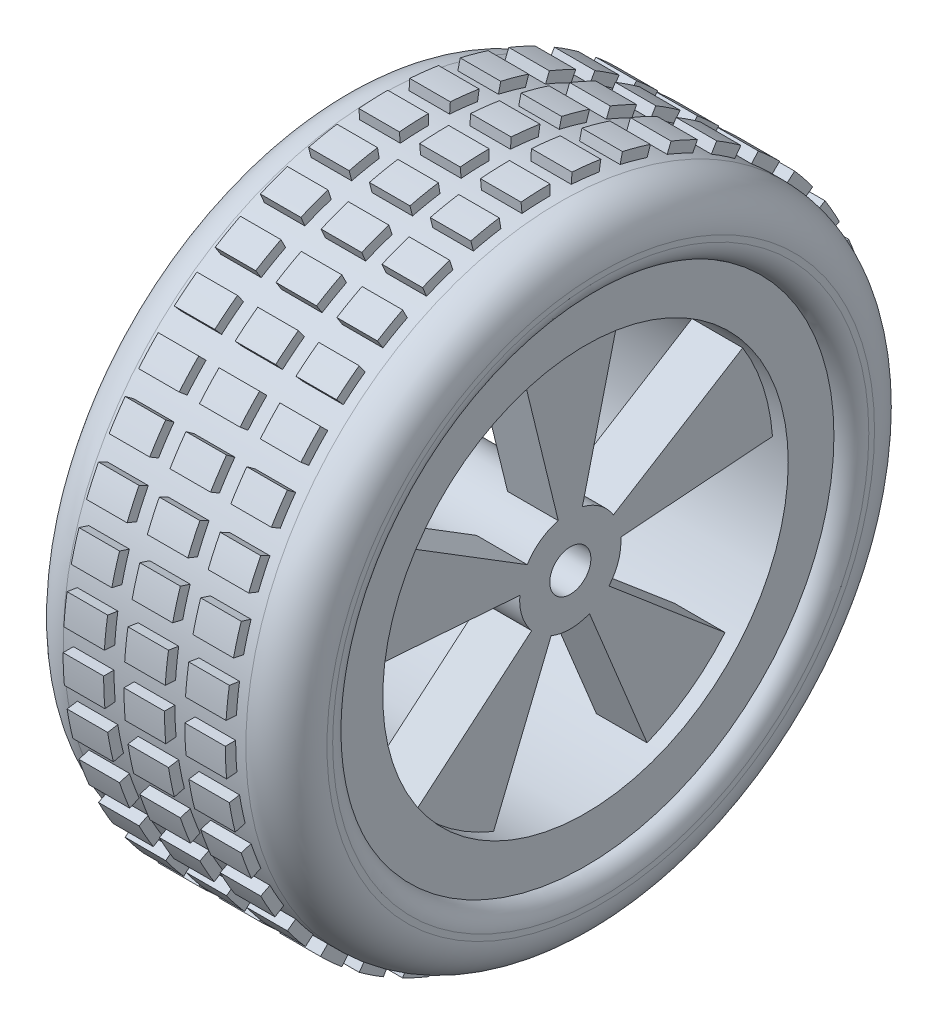
from build123d import *

# Parameters (mm, degrees)
BOSS_EXTRUDE1_DEPTH      = 13
BOSS_EXTRUDE1_DEPTH_BACK = 13
SKETCH2_R                = 31
CUT_EXTRUDE1_DEPTH       = 26
SKETCH4_R                = 2.02783292
CUT_EXTRUDE2_DEPTH       = 26
SKETCH5_R                = 19.992860578
CUT_EXTRUDE3_DEPTH       = 3
SKETCH6_R                = 24.5
CUT_EXTRUDE4_DEPTH       = 1.5
FILLET2_R                = 4
FILLET3_R                = 2
CUT_EXTRUDE5_START       = -18
SKETCH7_R                = 19.992860578
CUT_EXTRUDE5_DEPTH       = 18
SKETCH8_R                = 4.994799617
SKETCH8_R_2              = 2.02783292
BOSS_EXTRUDE2_DEPTH      = 19
BOSS_EXTRUDE3_DEPTH      = 2
MIRROR2_COPY_1_DEPTH     = 2
MIRROR2_COPY_2_DEPTH     = 2
CUT_EXTRUDE7_START       = -1
SKETCH11_R               = 24.5
SKETCH11_R_2             = 19.992860578
CUT_EXTRUDE7_DEPTH       = 1
FILLET4_R                = 1


# Some blends are built 0.0001 mm under size
with BuildPart() as part:
    # Sketch2 → Boss-Extrude1 (new, two sides: drawn at the far end of the back side and taken through both)
    with BuildSketch(Plane(origin=(0, 0, 0), x_dir=(0, 0, -1), z_dir=(1, 0, 0)).offset(-BOSS_EXTRUDE1_DEPTH_BACK)):
        Circle(SKETCH2_R)
    extrude(amount=BOSS_EXTRUDE1_DEPTH + BOSS_EXTRUDE1_DEPTH_BACK)

    # Sketch3 → Cut-Extrude1 (cut)
    with BuildSketch(Plane(origin=(13, 0, 0), x_dir=(0, 0, -1), z_dir=(1, 0, 0))):
        with BuildLine():
            ThreePointArc((1.186772646, 4.851761938), (2.935869553, 4.040877774), (4.247566891, 2.62796475))
            Line((4.247566891, 2.62796475), (17.001885791, 10.519047184))
            ThreePointArc((17.001885791, 10.519047184), (11.751508599, 16.174563974), (4.750336723, 19.420318615))
            Line((4.750336723, 19.420318615), (1.186772646, 4.851761938))
        make_face()
        with BuildLine():
            ThreePointArc((-4.247566891, 2.62796475), (-2.935869553, 4.040877774), (-1.186772646, 4.851761938))
            Line((-1.186772646, 4.851761938), (-4.750336723, 19.420318615))
            ThreePointArc((-4.750336723, 19.420318615), (-11.751508599, 16.174563974), (-17.001885791, 10.519047184))
            Line((-17.001885791, 10.519047184), (-4.247566891, 2.62796475))
        make_face()
        with BuildLine():
            Line((-15.258080015, -12.919189926), (-3.811913354, -3.227590401))
            ThreePointArc((-3.811913354, -3.227590401), (-4.750336723, -1.543477965), (-4.981032723, 0.370589033))
            Line((-4.981032723, 0.370589033), (-19.937755344, 1.483369793))
            ThreePointArc((-19.937755344, 1.483369793), (-19.014340332, -6.178133685), (-15.258080015, -12.919189926))
        make_face()
        with BuildLine():
            Line((7.571873739, -18.503545665), (1.891674876, -4.622725319))
            ThreePointArc((1.891674876, -4.622725319), (0, -4.994799617), (-1.891674876, -4.622725319))
            Line((-1.891674876, -4.622725319), (-7.571873739, -18.503545665))
            ThreePointArc((-7.571873739, -18.503545665), (0, -19.992860578), (7.571873739, -18.503545665))
        make_face()
        with BuildLine():
            Line((19.937755344, 1.483369793), (4.981032723, 0.370589033))
            ThreePointArc((4.981032723, 0.370589033), (4.991356707, 0.185422328), (4.994799617, 0))
            ThreePointArc((4.994799617, 0), (4.689763671, -1.718761161), (3.811913354, -3.227590401))
            Line((3.811913354, -3.227590401), (15.258080015, -12.919189926))
            ThreePointArc((15.258080015, -12.919189926), (18.771882438, -6.879745913), (19.992860578, 0))
            ThreePointArc((19.992860578, 0), (19.97907952, 0.742196492), (19.937755344, 1.483369793))
        make_face()
    extrude(amount=-CUT_EXTRUDE1_DEPTH, mode=Mode.SUBTRACT)

    # Sketch4 → Cut-Extrude2 (cut)
    with BuildSketch(Plane(origin=(13, 0, 0), x_dir=(0, 0, -1), z_dir=(1, 0, 0))):
        Circle(SKETCH4_R)
    extrude(amount=-CUT_EXTRUDE2_DEPTH, mode=Mode.SUBTRACT)

    # Sketch5 → Cut-Extrude3 (cut)
    with BuildSketch(Plane(origin=(13, 0, 0), x_dir=(0, 0, -1), z_dir=(1, 0, 0))):
        Circle(SKETCH5_R)
    extrude(amount=-CUT_EXTRUDE3_DEPTH, mode=Mode.SUBTRACT)

    # Sketch6 → Cut-Extrude4 (cut)
    with BuildSketch(Plane(origin=(13, 0, 0), x_dir=(0, 0, -1), z_dir=(1, 0, 0))):
        Circle(SKETCH6_R)
    extrude(amount=-CUT_EXTRUDE4_DEPTH, mode=Mode.SUBTRACT)

    # Fillet2
    fillet2_edges = [part.edges().sort_by_distance(p)[0] for p in [
        (-13, 0, 31),
        (13, 0, 31),
    ]]
    fillet(fillet2_edges, radius=FILLET2_R)

    # Fillet3
    # the kernel refuses this fillet: 2 mm, written as the material it takes off along each edge
    with BuildSketch(Plane(origin=(13, 0, 0), x_dir=(0, 0, -1), z_dir=(0, -1, 0))) as fillet3_piece_1:
        with BuildLine():
            CenterArc((26.436491673, -2), FILLET3_R, 90, 75.522487814)
            Line((24.5, -1.5), (24.461270167, -1.49))
            ThreePointArc((24.461270167, -1.49), (24.46, -0.75), (24.46, 0))
            Line((24.46, 0), (24.5, 0.04))
            Line((24.5, 0.04), (26.436491673, 0.04))
            Line((26.436491673, 0.04), (26.436491673, 0))
        make_face()
    revolve(axis=Axis((13, 0, 0), (1, 0, 0)), mode=Mode.SUBTRACT)

    # Sketch7 → Cut-Extrude5 (cut)
    with BuildSketch(Plane.ZY.offset(13).offset(CUT_EXTRUDE5_START)):
        with Locations(Location((0, 0, 0), (0, 0, 180))):
            Circle(SKETCH7_R)
    extrude(amount=CUT_EXTRUDE5_DEPTH, mode=Mode.SUBTRACT)

    # Sketch8 → Boss-Extrude2 (add)
    with BuildSketch(Plane.ZY.offset(-5)):
        with Locations(Location((0, 0, 0), (0, 0, 175.7450311))):
            Circle(SKETCH8_R)
        with Locations(Location((0, 0, 0), (0, 0, 180))):
            Circle(SKETCH8_R_2, mode=Mode.SUBTRACT)
    extrude(amount=BOSS_EXTRUDE2_DEPTH)

    # Sketch9 → Boss-Extrude3 (add, symmetric)
    with BuildSketch(Plane(origin=(0, 0, 0), x_dir=(0, 0, -1), z_dir=(1, 0, 0))):
        with BuildLine():
            Line((0, 31), (0, 32.019953226))
            ThreePointArc((0, 32.019953226), (-1.429439719, 31.988030678), (-2.856029255, 31.892326686))
            Line((-2.856029255, 31.892326686), (-2.765054224, 30.876438835))
            ThreePointArc((-2.765054224, 30.876438835), (-1.383906809, 30.969094303), (0, 31))
        make_face()
        with BuildLine():
            Line((2.099127373, 30.928848415), (2.168192268, 31.946460631))
            ThreePointArc((2.168192268, 31.946460631), (3.592189523, 31.817818577), (5.009024253, 31.625734467))
            Line((5.009024253, 31.625734467), (4.849468416, 30.618338558))
            ThreePointArc((4.849468416, 30.618338558), (3.47776508, 30.804304083), (2.099127373, 30.928848415))
        make_face()
        with BuildLine():
            Line((6.911621488, 30.2196871), (7.139025702, 31.213966691))
            ThreePointArc((7.139025702, 31.213966691), (8.525367137, 30.864146185), (9.894709706, 30.452785167))
            Line((9.894709706, 30.452785167), (9.579526826, 29.482752005))
            ThreePointArc((9.579526826, 29.482752005), (8.253802851, 29.881009663), (6.911621488, 30.2196871))
        make_face()
        with BuildLine():
            Line((11.553928544, 28.766416795), (11.93407263, 29.712881298))
            ThreePointArc((11.93407263, 29.712881298), (13.248621918, 29.150496082), (14.536754567, 28.529987228))
            Line((14.536754567, 28.529987228), (14.073705492, 27.62120225))
            ThreePointArc((14.073705492, 27.62120225), (12.826604603, 28.221945616), (11.553928544, 28.766416795))
        make_face()
        with BuildLine():
            Line((15.911739533, 26.604821838), (16.435263083, 27.480166156))
            ThreePointArc((16.435263083, 27.480166156), (17.645651657, 26.719064021), (18.820856285, 25.904686319))
            Line((18.820856285, 25.904686319), (18.221342821, 25.079526826))
            ThreePointArc((18.221342821, 25.079526826), (17.083572781, 25.867963604), (15.911739533, 26.604821838))
        make_face()
        with BuildLine():
            Line((19.877750687, 23.788127871), (20.531762814, 24.570798121))
            ThreePointArc((20.531762814, 24.570798121), (21.608186891, 23.629719928), (22.641526059, 22.641526059))
            Line((22.641526059, 22.641526059), (21.920310217, 21.920310217))
            ThreePointArc((21.920310217, 21.920310217), (20.9198867, 22.877026478), (19.877750687, 23.788127871))
        make_face()
        with BuildLine():
            Line((23.354305649, 20.385691248), (24.122702403, 21.056415492))
            ThreePointArc((24.122702403, 21.056415492), (25.038656849, 19.958533708), (25.904686319, 18.820856285))
            Line((25.904686319, 18.820856285), (25.079526826, 18.221342821))
            ThreePointArc((25.079526826, 18.221342821), (24.241083579, 19.322781035), (23.354305649, 20.385691248))
        make_face()
        with BuildLine():
            Line((26.255800097, 16.48129125), (27.119661, 17.02355403))
            ThreePointArc((27.119661, 17.02355403), (27.852591978, 15.795902149), (28.529987228, 14.536754567))
            Line((28.529987228, 14.536754567), (27.62120225, 14.073705492))
            ThreePointArc((27.62120225, 14.073705492), (26.965384528, 15.292744595), (26.255800097, 16.48129125))
        make_face()
        with BuildLine():
            Line((28.510789609, 12.171067164), (29.448843538, 12.57151617))
            ThreePointArc((29.448843538, 12.57151617), (29.980703854, 11.244323056), (30.452785167, 9.894709706))
            Line((30.452785167, 9.894709706), (29.482752005, 9.579526826))
            ThreePointArc((29.482752005, 9.579526826), (29.025708218, 10.886150029), (28.510789609, 12.171067164))
        make_face()
        with BuildLine():
            Line((30.063748858, 7.56115101), (31.052897814, 7.80992586))
            ThreePointArc((31.052897814, 7.80992586), (31.370591302, 6.415871411), (31.625734467, 5.009024253))
            Line((31.625734467, 5.009024253), (30.618338558, 4.849468416))
            ThreePointArc((30.618338558, 4.849468416), (30.37132264, 6.21150232), (30.063748858, 7.56115101))
        make_face()
        with BuildLine():
            Line((30.876438835, 2.765054224), (31.892326686, 2.856029255))
            ThreePointArc((31.892326686, 2.856029255), (31.988030678, 1.429439719), (32.019953226, 0))
            Line((32.019953226, 0), (31, 0))
            ThreePointArc((31, 0), (30.969094303, 1.383906809), (30.876438835, 2.765054224))
        make_face()
        with BuildLine():
            Line((30.928848415, -2.099127373), (31.946460631, -2.168192268))
            ThreePointArc((31.946460631, -2.168192268), (31.817818577, -3.592189523), (31.625734467, -5.009024253))
            Line((31.625734467, -5.009024253), (30.618338558, -4.849468416))
            ThreePointArc((30.618338558, -4.849468416), (30.804304083, -3.47776508), (30.928848415, -2.099127373))
        make_face()
        with BuildLine():
            Line((30.2196871, -6.911621488), (31.213966691, -7.139025702))
            ThreePointArc((31.213966691, -7.139025702), (30.864146185, -8.525367137), (30.452785167, -9.894709706))
            Line((30.452785167, -9.894709706), (29.482752005, -9.579526826))
            ThreePointArc((29.482752005, -9.579526826), (29.881009663, -8.253802851), (30.2196871, -6.911621488))
        make_face()
        with BuildLine():
            Line((28.766416795, -11.553928544), (29.712881298, -11.93407263))
            ThreePointArc((29.712881298, -11.93407263), (29.150496082, -13.248621918), (28.529987228, -14.536754567))
            Line((28.529987228, -14.536754567), (27.62120225, -14.073705492))
            ThreePointArc((27.62120225, -14.073705492), (28.221945616, -12.826604603), (28.766416795, -11.553928544))
        make_face()
        with BuildLine():
            Line((26.604821838, -15.911739533), (27.480166156, -16.435263083))
            ThreePointArc((27.480166156, -16.435263083), (26.719064021, -17.645651657), (25.904686319, -18.820856285))
            Line((25.904686319, -18.820856285), (25.079526826, -18.221342821))
            ThreePointArc((25.079526826, -18.221342821), (25.867963604, -17.083572781), (26.604821838, -15.911739533))
        make_face()
        with BuildLine():
            Line((23.788127871, -19.877750687), (24.570798121, -20.531762814))
            ThreePointArc((24.570798121, -20.531762814), (23.629719928, -21.608186891), (22.641526059, -22.641526059))
            Line((22.641526059, -22.641526059), (21.920310217, -21.920310217))
            ThreePointArc((21.920310217, -21.920310217), (22.877026478, -20.9198867), (23.788127871, -19.877750687))
        make_face()
        with BuildLine():
            Line((20.385691248, -23.354305649), (21.056415492, -24.122702403))
            ThreePointArc((21.056415492, -24.122702403), (19.958533708, -25.038656849), (18.820856285, -25.904686319))
            Line((18.820856285, -25.904686319), (18.221342821, -25.079526826))
            ThreePointArc((18.221342821, -25.079526826), (19.322781035, -24.241083579), (20.385691248, -23.354305649))
        make_face()
        with BuildLine():
            Line((16.48129125, -26.255800097), (17.02355403, -27.119661))
            ThreePointArc((17.02355403, -27.119661), (15.795902149, -27.852591978), (14.536754567, -28.529987228))
            Line((14.536754567, -28.529987228), (14.073705492, -27.62120225))
            ThreePointArc((14.073705492, -27.62120225), (15.292744595, -26.965384528), (16.48129125, -26.255800097))
        make_face()
        with BuildLine():
            Line((12.171067164, -28.510789609), (12.57151617, -29.448843538))
            ThreePointArc((12.57151617, -29.448843538), (11.244323056, -29.980703854), (9.894709706, -30.452785167))
            Line((9.894709706, -30.452785167), (9.579526826, -29.482752005))
            ThreePointArc((9.579526826, -29.482752005), (10.886150029, -29.025708218), (12.171067164, -28.510789609))
        make_face()
        with BuildLine():
            Line((7.56115101, -30.063748858), (7.80992586, -31.052897814))
            ThreePointArc((7.80992586, -31.052897814), (6.415871411, -31.370591302), (5.009024253, -31.625734467))
            Line((5.009024253, -31.625734467), (4.849468416, -30.618338558))
            ThreePointArc((4.849468416, -30.618338558), (6.21150232, -30.37132264), (7.56115101, -30.063748858))
        make_face()
        with BuildLine():
            Line((2.765054224, -30.876438835), (2.856029255, -31.892326686))
            ThreePointArc((2.856029255, -31.892326686), (1.429439719, -31.988030678), (0, -32.019953226))
            Line((0, -32.019953226), (0, -31))
            ThreePointArc((0, -31), (1.383906809, -30.969094303), (2.765054224, -30.876438835))
        make_face()
        with BuildLine():
            Line((-2.099127373, -30.928848415), (-2.168192268, -31.946460631))
            ThreePointArc((-2.168192268, -31.946460631), (-3.592189523, -31.817818577), (-5.009024253, -31.625734467))
            Line((-5.009024253, -31.625734467), (-4.849468416, -30.618338558))
            ThreePointArc((-4.849468416, -30.618338558), (-3.47776508, -30.804304083), (-2.099127373, -30.928848415))
        make_face()
        with BuildLine():
            Line((-6.911621488, -30.2196871), (-7.139025702, -31.213966691))
            ThreePointArc((-7.139025702, -31.213966691), (-8.525367137, -30.864146185), (-9.894709706, -30.452785167))
            Line((-9.894709706, -30.452785167), (-9.579526826, -29.482752005))
            ThreePointArc((-9.579526826, -29.482752005), (-8.253802851, -29.881009663), (-6.911621488, -30.2196871))
        make_face()
        with BuildLine():
            Line((-11.553928544, -28.766416795), (-11.93407263, -29.712881298))
            ThreePointArc((-11.93407263, -29.712881298), (-13.248621918, -29.150496082), (-14.536754567, -28.529987228))
            Line((-14.536754567, -28.529987228), (-14.073705492, -27.62120225))
            ThreePointArc((-14.073705492, -27.62120225), (-12.826604603, -28.221945616), (-11.553928544, -28.766416795))
        make_face()
        with BuildLine():
            Line((-15.911739533, -26.604821838), (-16.435263083, -27.480166156))
            ThreePointArc((-16.435263083, -27.480166156), (-17.645651657, -26.719064021), (-18.820856285, -25.904686319))
            Line((-18.820856285, -25.904686319), (-18.221342821, -25.079526826))
            ThreePointArc((-18.221342821, -25.079526826), (-17.083572781, -25.867963604), (-15.911739533, -26.604821838))
        make_face()
        with BuildLine():
            Line((-19.877750687, -23.788127871), (-20.531762814, -24.570798121))
            ThreePointArc((-20.531762814, -24.570798121), (-21.608186891, -23.629719928), (-22.641526059, -22.641526059))
            Line((-22.641526059, -22.641526059), (-21.920310217, -21.920310217))
            ThreePointArc((-21.920310217, -21.920310217), (-20.9198867, -22.877026478), (-19.877750687, -23.788127871))
        make_face()
        with BuildLine():
            Line((-23.354305649, -20.385691248), (-24.122702403, -21.056415492))
            ThreePointArc((-24.122702403, -21.056415492), (-25.038656849, -19.958533708), (-25.904686319, -18.820856285))
            Line((-25.904686319, -18.820856285), (-25.079526826, -18.221342821))
            ThreePointArc((-25.079526826, -18.221342821), (-24.241083579, -19.322781035), (-23.354305649, -20.385691248))
        make_face()
        with BuildLine():
            Line((-26.255800097, -16.48129125), (-27.119661, -17.02355403))
            ThreePointArc((-27.119661, -17.02355403), (-27.852591978, -15.795902149), (-28.529987228, -14.536754567))
            Line((-28.529987228, -14.536754567), (-27.62120225, -14.073705492))
            ThreePointArc((-27.62120225, -14.073705492), (-26.965384528, -15.292744595), (-26.255800097, -16.48129125))
        make_face()
        with BuildLine():
            Line((-28.510789609, -12.171067164), (-29.448843538, -12.57151617))
            ThreePointArc((-29.448843538, -12.57151617), (-29.980703854, -11.244323056), (-30.452785167, -9.894709706))
            Line((-30.452785167, -9.894709706), (-29.482752005, -9.579526826))
            ThreePointArc((-29.482752005, -9.579526826), (-29.025708218, -10.886150029), (-28.510789609, -12.171067164))
        make_face()
        with BuildLine():
            Line((-30.063748858, -7.56115101), (-31.052897814, -7.80992586))
            ThreePointArc((-31.052897814, -7.80992586), (-31.370591302, -6.415871411), (-31.625734467, -5.009024253))
            Line((-31.625734467, -5.009024253), (-30.618338558, -4.849468416))
            ThreePointArc((-30.618338558, -4.849468416), (-30.37132264, -6.21150232), (-30.063748858, -7.56115101))
        make_face()
        with BuildLine():
            Line((-30.876438835, -2.765054224), (-31.892326686, -2.856029255))
            ThreePointArc((-31.892326686, -2.856029255), (-31.988030678, -1.429439719), (-32.019953226, 0))
            Line((-32.019953226, 0), (-31, 0))
            ThreePointArc((-31, 0), (-30.969094303, -1.383906809), (-30.876438835, -2.765054224))
        make_face()
        with BuildLine():
            Line((-30.928848415, 2.099127373), (-31.946460631, 2.168192268))
            ThreePointArc((-31.946460631, 2.168192268), (-31.817818577, 3.592189523), (-31.625734467, 5.009024253))
            Line((-31.625734467, 5.009024253), (-30.618338558, 4.849468416))
            ThreePointArc((-30.618338558, 4.849468416), (-30.804304083, 3.47776508), (-30.928848415, 2.099127373))
        make_face()
        with BuildLine():
            Line((-30.2196871, 6.911621488), (-31.213966691, 7.139025702))
            ThreePointArc((-31.213966691, 7.139025702), (-30.864146185, 8.525367137), (-30.452785167, 9.894709706))
            Line((-30.452785167, 9.894709706), (-29.482752005, 9.579526826))
            ThreePointArc((-29.482752005, 9.579526826), (-29.881009663, 8.253802851), (-30.2196871, 6.911621488))
        make_face()
        with BuildLine():
            Line((-28.766416795, 11.553928544), (-29.712881298, 11.93407263))
            ThreePointArc((-29.712881298, 11.93407263), (-29.150496082, 13.248621918), (-28.529987228, 14.536754567))
            Line((-28.529987228, 14.536754567), (-27.62120225, 14.073705492))
            ThreePointArc((-27.62120225, 14.073705492), (-28.221945616, 12.826604603), (-28.766416795, 11.553928544))
        make_face()
        with BuildLine():
            Line((-26.604821838, 15.911739533), (-27.480166156, 16.435263083))
            ThreePointArc((-27.480166156, 16.435263083), (-26.719064021, 17.645651657), (-25.904686319, 18.820856285))
            Line((-25.904686319, 18.820856285), (-25.079526826, 18.221342821))
            ThreePointArc((-25.079526826, 18.221342821), (-25.867963604, 17.083572781), (-26.604821838, 15.911739533))
        make_face()
        with BuildLine():
            Line((-23.788127871, 19.877750687), (-24.570798121, 20.531762814))
            ThreePointArc((-24.570798121, 20.531762814), (-23.629719928, 21.608186891), (-22.641526059, 22.641526059))
            Line((-22.641526059, 22.641526059), (-21.920310217, 21.920310217))
            ThreePointArc((-21.920310217, 21.920310217), (-22.877026478, 20.9198867), (-23.788127871, 19.877750687))
        make_face()
        with BuildLine():
            Line((-20.385691248, 23.354305649), (-21.056415492, 24.122702403))
            ThreePointArc((-21.056415492, 24.122702403), (-19.958533708, 25.038656849), (-18.820856285, 25.904686319))
            Line((-18.820856285, 25.904686319), (-18.221342821, 25.079526826))
            ThreePointArc((-18.221342821, 25.079526826), (-19.322781035, 24.241083579), (-20.385691248, 23.354305649))
        make_face()
        with BuildLine():
            Line((-16.48129125, 26.255800097), (-17.02355403, 27.119661))
            ThreePointArc((-17.02355403, 27.119661), (-15.795902149, 27.852591978), (-14.536754567, 28.529987228))
            Line((-14.536754567, 28.529987228), (-14.073705492, 27.62120225))
            ThreePointArc((-14.073705492, 27.62120225), (-15.292744595, 26.965384528), (-16.48129125, 26.255800097))
        make_face()
        with BuildLine():
            Line((-12.171067164, 28.510789609), (-12.57151617, 29.448843538))
            ThreePointArc((-12.57151617, 29.448843538), (-11.244323056, 29.980703854), (-9.894709706, 30.452785167))
            Line((-9.894709706, 30.452785167), (-9.579526826, 29.482752005))
            ThreePointArc((-9.579526826, 29.482752005), (-10.886150029, 29.025708218), (-12.171067164, 28.510789609))
        make_face()
        with BuildLine():
            Line((-7.56115101, 30.063748858), (-7.80992586, 31.052897814))
            ThreePointArc((-7.80992586, 31.052897814), (-6.415871411, 31.370591302), (-5.009024253, 31.625734467))
            Line((-5.009024253, 31.625734467), (-4.849468416, 30.618338558))
            ThreePointArc((-4.849468416, 30.618338558), (-6.21150232, 30.37132264), (-7.56115101, 30.063748858))
        make_face()
    boss_extrude3 = extrude(amount=BOSS_EXTRUDE3_DEPTH, both=True)

    # Mirror1: Boss-Extrude3 across plane
    add(boss_extrude3.mirror(Plane(origin=(3, 0, 0), x_dir=(0, 0, 1), z_dir=(1, 0, 0))))

    # Mirror2 copy 1 sketch → Mirror2 copy 1 (add, symmetric)
    with BuildSketch(Plane(origin=(-6, 0, 0), x_dir=(0, 0, -1), z_dir=(1, 0, 0))):
        with BuildLine():
            Line((0, 31), (0, 32.019953226))
            ThreePointArc((0, 32.019953226), (-1.429439719, 31.988030678), (-2.856029255, 31.892326686))
            Line((-2.856029255, 31.892326686), (-2.765054224, 30.876438835))
            ThreePointArc((-2.765054224, 30.876438835), (-1.383906809, 30.969094303), (0, 31))
        make_face()
        with BuildLine():
            Line((2.099127373, 30.928848415), (2.168192268, 31.946460631))
            ThreePointArc((2.168192268, 31.946460631), (3.592189523, 31.817818577), (5.009024253, 31.625734467))
            Line((5.009024253, 31.625734467), (4.849468416, 30.618338558))
            ThreePointArc((4.849468416, 30.618338558), (3.47776508, 30.804304083), (2.099127373, 30.928848415))
        make_face()
        with BuildLine():
            Line((6.911621488, 30.2196871), (7.139025702, 31.213966691))
            ThreePointArc((7.139025702, 31.213966691), (8.525367137, 30.864146185), (9.894709706, 30.452785167))
            Line((9.894709706, 30.452785167), (9.579526826, 29.482752005))
            ThreePointArc((9.579526826, 29.482752005), (8.253802851, 29.881009663), (6.911621488, 30.2196871))
        make_face()
        with BuildLine():
            Line((11.553928544, 28.766416795), (11.93407263, 29.712881298))
            ThreePointArc((11.93407263, 29.712881298), (13.248621918, 29.150496082), (14.536754567, 28.529987228))
            Line((14.536754567, 28.529987228), (14.073705492, 27.62120225))
            ThreePointArc((14.073705492, 27.62120225), (12.826604603, 28.221945616), (11.553928544, 28.766416795))
        make_face()
        with BuildLine():
            Line((15.911739533, 26.604821838), (16.435263083, 27.480166156))
            ThreePointArc((16.435263083, 27.480166156), (17.645651657, 26.719064021), (18.820856285, 25.904686319))
            Line((18.820856285, 25.904686319), (18.221342821, 25.079526826))
            ThreePointArc((18.221342821, 25.079526826), (17.083572781, 25.867963604), (15.911739533, 26.604821838))
        make_face()
        with BuildLine():
            Line((19.877750687, 23.788127871), (20.531762814, 24.570798121))
            ThreePointArc((20.531762814, 24.570798121), (21.608186891, 23.629719928), (22.641526059, 22.641526059))
            Line((22.641526059, 22.641526059), (21.920310217, 21.920310217))
            ThreePointArc((21.920310217, 21.920310217), (20.9198867, 22.877026478), (19.877750687, 23.788127871))
        make_face()
        with BuildLine():
            Line((23.354305649, 20.385691248), (24.122702403, 21.056415492))
            ThreePointArc((24.122702403, 21.056415492), (25.038656849, 19.958533708), (25.904686319, 18.820856285))
            Line((25.904686319, 18.820856285), (25.079526826, 18.221342821))
            ThreePointArc((25.079526826, 18.221342821), (24.241083579, 19.322781035), (23.354305649, 20.385691248))
        make_face()
        with BuildLine():
            Line((26.255800097, 16.48129125), (27.119661, 17.02355403))
            ThreePointArc((27.119661, 17.02355403), (27.852591978, 15.795902149), (28.529987228, 14.536754567))
            Line((28.529987228, 14.536754567), (27.62120225, 14.073705492))
            ThreePointArc((27.62120225, 14.073705492), (26.965384528, 15.292744595), (26.255800097, 16.48129125))
        make_face()
        with BuildLine():
            Line((28.510789609, 12.171067164), (29.448843538, 12.57151617))
            ThreePointArc((29.448843538, 12.57151617), (29.980703854, 11.244323056), (30.452785167, 9.894709706))
            Line((30.452785167, 9.894709706), (29.482752005, 9.579526826))
            ThreePointArc((29.482752005, 9.579526826), (29.025708218, 10.886150029), (28.510789609, 12.171067164))
        make_face()
        with BuildLine():
            Line((30.063748858, 7.56115101), (31.052897814, 7.80992586))
            ThreePointArc((31.052897814, 7.80992586), (31.370591302, 6.415871411), (31.625734467, 5.009024253))
            Line((31.625734467, 5.009024253), (30.618338558, 4.849468416))
            ThreePointArc((30.618338558, 4.849468416), (30.37132264, 6.21150232), (30.063748858, 7.56115101))
        make_face()
        with BuildLine():
            Line((30.876438835, 2.765054224), (31.892326686, 2.856029255))
            ThreePointArc((31.892326686, 2.856029255), (31.988030678, 1.429439719), (32.019953226, 0))
            Line((32.019953226, 0), (31, 0))
            ThreePointArc((31, 0), (30.969094303, 1.383906809), (30.876438835, 2.765054224))
        make_face()
        with BuildLine():
            Line((30.928848415, -2.099127373), (31.946460631, -2.168192268))
            ThreePointArc((31.946460631, -2.168192268), (31.817818577, -3.592189523), (31.625734467, -5.009024253))
            Line((31.625734467, -5.009024253), (30.618338558, -4.849468416))
            ThreePointArc((30.618338558, -4.849468416), (30.804304083, -3.47776508), (30.928848415, -2.099127373))
        make_face()
        with BuildLine():
            Line((30.2196871, -6.911621488), (31.213966691, -7.139025702))
            ThreePointArc((31.213966691, -7.139025702), (30.864146185, -8.525367137), (30.452785167, -9.894709706))
            Line((30.452785167, -9.894709706), (29.482752005, -9.579526826))
            ThreePointArc((29.482752005, -9.579526826), (29.881009663, -8.253802851), (30.2196871, -6.911621488))
        make_face()
        with BuildLine():
            Line((28.766416795, -11.553928544), (29.712881298, -11.93407263))
            ThreePointArc((29.712881298, -11.93407263), (29.150496082, -13.248621918), (28.529987228, -14.536754567))
            Line((28.529987228, -14.536754567), (27.62120225, -14.073705492))
            ThreePointArc((27.62120225, -14.073705492), (28.221945616, -12.826604603), (28.766416795, -11.553928544))
        make_face()
        with BuildLine():
            Line((26.604821838, -15.911739533), (27.480166156, -16.435263083))
            ThreePointArc((27.480166156, -16.435263083), (26.719064021, -17.645651657), (25.904686319, -18.820856285))
            Line((25.904686319, -18.820856285), (25.079526826, -18.221342821))
            ThreePointArc((25.079526826, -18.221342821), (25.867963604, -17.083572781), (26.604821838, -15.911739533))
        make_face()
        with BuildLine():
            Line((23.788127871, -19.877750687), (24.570798121, -20.531762814))
            ThreePointArc((24.570798121, -20.531762814), (23.629719928, -21.608186891), (22.641526059, -22.641526059))
            Line((22.641526059, -22.641526059), (21.920310217, -21.920310217))
            ThreePointArc((21.920310217, -21.920310217), (22.877026478, -20.9198867), (23.788127871, -19.877750687))
        make_face()
        with BuildLine():
            Line((20.385691248, -23.354305649), (21.056415492, -24.122702403))
            ThreePointArc((21.056415492, -24.122702403), (19.958533708, -25.038656849), (18.820856285, -25.904686319))
            Line((18.820856285, -25.904686319), (18.221342821, -25.079526826))
            ThreePointArc((18.221342821, -25.079526826), (19.322781035, -24.241083579), (20.385691248, -23.354305649))
        make_face()
        with BuildLine():
            Line((16.48129125, -26.255800097), (17.02355403, -27.119661))
            ThreePointArc((17.02355403, -27.119661), (15.795902149, -27.852591978), (14.536754567, -28.529987228))
            Line((14.536754567, -28.529987228), (14.073705492, -27.62120225))
            ThreePointArc((14.073705492, -27.62120225), (15.292744595, -26.965384528), (16.48129125, -26.255800097))
        make_face()
        with BuildLine():
            Line((12.171067164, -28.510789609), (12.57151617, -29.448843538))
            ThreePointArc((12.57151617, -29.448843538), (11.244323056, -29.980703854), (9.894709706, -30.452785167))
            Line((9.894709706, -30.452785167), (9.579526826, -29.482752005))
            ThreePointArc((9.579526826, -29.482752005), (10.886150029, -29.025708218), (12.171067164, -28.510789609))
        make_face()
        with BuildLine():
            Line((7.56115101, -30.063748858), (7.80992586, -31.052897814))
            ThreePointArc((7.80992586, -31.052897814), (6.415871411, -31.370591302), (5.009024253, -31.625734467))
            Line((5.009024253, -31.625734467), (4.849468416, -30.618338558))
            ThreePointArc((4.849468416, -30.618338558), (6.21150232, -30.37132264), (7.56115101, -30.063748858))
        make_face()
        with BuildLine():
            Line((2.765054224, -30.876438835), (2.856029255, -31.892326686))
            ThreePointArc((2.856029255, -31.892326686), (1.429439719, -31.988030678), (0, -32.019953226))
            Line((0, -32.019953226), (0, -31))
            ThreePointArc((0, -31), (1.383906809, -30.969094303), (2.765054224, -30.876438835))
        make_face()
        with BuildLine():
            Line((-2.099127373, -30.928848415), (-2.168192268, -31.946460631))
            ThreePointArc((-2.168192268, -31.946460631), (-3.592189523, -31.817818577), (-5.009024253, -31.625734467))
            Line((-5.009024253, -31.625734467), (-4.849468416, -30.618338558))
            ThreePointArc((-4.849468416, -30.618338558), (-3.47776508, -30.804304083), (-2.099127373, -30.928848415))
        make_face()
        with BuildLine():
            Line((-6.911621488, -30.2196871), (-7.139025702, -31.213966691))
            ThreePointArc((-7.139025702, -31.213966691), (-8.525367137, -30.864146185), (-9.894709706, -30.452785167))
            Line((-9.894709706, -30.452785167), (-9.579526826, -29.482752005))
            ThreePointArc((-9.579526826, -29.482752005), (-8.253802851, -29.881009663), (-6.911621488, -30.2196871))
        make_face()
        with BuildLine():
            Line((-11.553928544, -28.766416795), (-11.93407263, -29.712881298))
            ThreePointArc((-11.93407263, -29.712881298), (-13.248621918, -29.150496082), (-14.536754567, -28.529987228))
            Line((-14.536754567, -28.529987228), (-14.073705492, -27.62120225))
            ThreePointArc((-14.073705492, -27.62120225), (-12.826604603, -28.221945616), (-11.553928544, -28.766416795))
        make_face()
        with BuildLine():
            Line((-15.911739533, -26.604821838), (-16.435263083, -27.480166156))
            ThreePointArc((-16.435263083, -27.480166156), (-17.645651657, -26.719064021), (-18.820856285, -25.904686319))
            Line((-18.820856285, -25.904686319), (-18.221342821, -25.079526826))
            ThreePointArc((-18.221342821, -25.079526826), (-17.083572781, -25.867963604), (-15.911739533, -26.604821838))
        make_face()
        with BuildLine():
            Line((-19.877750687, -23.788127871), (-20.531762814, -24.570798121))
            ThreePointArc((-20.531762814, -24.570798121), (-21.608186891, -23.629719928), (-22.641526059, -22.641526059))
            Line((-22.641526059, -22.641526059), (-21.920310217, -21.920310217))
            ThreePointArc((-21.920310217, -21.920310217), (-20.9198867, -22.877026478), (-19.877750687, -23.788127871))
        make_face()
        with BuildLine():
            Line((-23.354305649, -20.385691248), (-24.122702403, -21.056415492))
            ThreePointArc((-24.122702403, -21.056415492), (-25.038656849, -19.958533708), (-25.904686319, -18.820856285))
            Line((-25.904686319, -18.820856285), (-25.079526826, -18.221342821))
            ThreePointArc((-25.079526826, -18.221342821), (-24.241083579, -19.322781035), (-23.354305649, -20.385691248))
        make_face()
        with BuildLine():
            Line((-26.255800097, -16.48129125), (-27.119661, -17.02355403))
            ThreePointArc((-27.119661, -17.02355403), (-27.852591978, -15.795902149), (-28.529987228, -14.536754567))
            Line((-28.529987228, -14.536754567), (-27.62120225, -14.073705492))
            ThreePointArc((-27.62120225, -14.073705492), (-26.965384528, -15.292744595), (-26.255800097, -16.48129125))
        make_face()
        with BuildLine():
            Line((-28.510789609, -12.171067164), (-29.448843538, -12.57151617))
            ThreePointArc((-29.448843538, -12.57151617), (-29.980703854, -11.244323056), (-30.452785167, -9.894709706))
            Line((-30.452785167, -9.894709706), (-29.482752005, -9.579526826))
            ThreePointArc((-29.482752005, -9.579526826), (-29.025708218, -10.886150029), (-28.510789609, -12.171067164))
        make_face()
        with BuildLine():
            Line((-30.063748858, -7.56115101), (-31.052897814, -7.80992586))
            ThreePointArc((-31.052897814, -7.80992586), (-31.370591302, -6.415871411), (-31.625734467, -5.009024253))
            Line((-31.625734467, -5.009024253), (-30.618338558, -4.849468416))
            ThreePointArc((-30.618338558, -4.849468416), (-30.37132264, -6.21150232), (-30.063748858, -7.56115101))
        make_face()
        with BuildLine():
            Line((-30.876438835, -2.765054224), (-31.892326686, -2.856029255))
            ThreePointArc((-31.892326686, -2.856029255), (-31.988030678, -1.429439719), (-32.019953226, 0))
            Line((-32.019953226, 0), (-31, 0))
            ThreePointArc((-31, 0), (-30.969094303, -1.383906809), (-30.876438835, -2.765054224))
        make_face()
        with BuildLine():
            Line((-30.928848415, 2.099127373), (-31.946460631, 2.168192268))
            ThreePointArc((-31.946460631, 2.168192268), (-31.817818577, 3.592189523), (-31.625734467, 5.009024253))
            Line((-31.625734467, 5.009024253), (-30.618338558, 4.849468416))
            ThreePointArc((-30.618338558, 4.849468416), (-30.804304083, 3.47776508), (-30.928848415, 2.099127373))
        make_face()
        with BuildLine():
            Line((-30.2196871, 6.911621488), (-31.213966691, 7.139025702))
            ThreePointArc((-31.213966691, 7.139025702), (-30.864146185, 8.525367137), (-30.452785167, 9.894709706))
            Line((-30.452785167, 9.894709706), (-29.482752005, 9.579526826))
            ThreePointArc((-29.482752005, 9.579526826), (-29.881009663, 8.253802851), (-30.2196871, 6.911621488))
        make_face()
        with BuildLine():
            Line((-28.766416795, 11.553928544), (-29.712881298, 11.93407263))
            ThreePointArc((-29.712881298, 11.93407263), (-29.150496082, 13.248621918), (-28.529987228, 14.536754567))
            Line((-28.529987228, 14.536754567), (-27.62120225, 14.073705492))
            ThreePointArc((-27.62120225, 14.073705492), (-28.221945616, 12.826604603), (-28.766416795, 11.553928544))
        make_face()
        with BuildLine():
            Line((-26.604821838, 15.911739533), (-27.480166156, 16.435263083))
            ThreePointArc((-27.480166156, 16.435263083), (-26.719064021, 17.645651657), (-25.904686319, 18.820856285))
            Line((-25.904686319, 18.820856285), (-25.079526826, 18.221342821))
            ThreePointArc((-25.079526826, 18.221342821), (-25.867963604, 17.083572781), (-26.604821838, 15.911739533))
        make_face()
        with BuildLine():
            Line((-23.788127871, 19.877750687), (-24.570798121, 20.531762814))
            ThreePointArc((-24.570798121, 20.531762814), (-23.629719928, 21.608186891), (-22.641526059, 22.641526059))
            Line((-22.641526059, 22.641526059), (-21.920310217, 21.920310217))
            ThreePointArc((-21.920310217, 21.920310217), (-22.877026478, 20.9198867), (-23.788127871, 19.877750687))
        make_face()
        with BuildLine():
            Line((-20.385691248, 23.354305649), (-21.056415492, 24.122702403))
            ThreePointArc((-21.056415492, 24.122702403), (-19.958533708, 25.038656849), (-18.820856285, 25.904686319))
            Line((-18.820856285, 25.904686319), (-18.221342821, 25.079526826))
            ThreePointArc((-18.221342821, 25.079526826), (-19.322781035, 24.241083579), (-20.385691248, 23.354305649))
        make_face()
        with BuildLine():
            Line((-16.48129125, 26.255800097), (-17.02355403, 27.119661))
            ThreePointArc((-17.02355403, 27.119661), (-15.795902149, 27.852591978), (-14.536754567, 28.529987228))
            Line((-14.536754567, 28.529987228), (-14.073705492, 27.62120225))
            ThreePointArc((-14.073705492, 27.62120225), (-15.292744595, 26.965384528), (-16.48129125, 26.255800097))
        make_face()
        with BuildLine():
            Line((-12.171067164, 28.510789609), (-12.57151617, 29.448843538))
            ThreePointArc((-12.57151617, 29.448843538), (-11.244323056, 29.980703854), (-9.894709706, 30.452785167))
            Line((-9.894709706, 30.452785167), (-9.579526826, 29.482752005))
            ThreePointArc((-9.579526826, 29.482752005), (-10.886150029, 29.025708218), (-12.171067164, 28.510789609))
        make_face()
        with BuildLine():
            Line((-7.56115101, 30.063748858), (-7.80992586, 31.052897814))
            ThreePointArc((-7.80992586, 31.052897814), (-6.415871411, 31.370591302), (-5.009024253, 31.625734467))
            Line((-5.009024253, 31.625734467), (-4.849468416, 30.618338558))
            ThreePointArc((-4.849468416, 30.618338558), (-6.21150232, 30.37132264), (-7.56115101, 30.063748858))
        make_face()
    extrude(amount=MIRROR2_COPY_1_DEPTH, both=True)

    # Mirror2 copy 2 sketch → Mirror2 copy 2 (add, symmetric)
    with BuildSketch(Plane(origin=(0, 0, 0), x_dir=(0, 0, -1), z_dir=(-1, 0, 0))):
        with BuildLine():
            Line((0, -31), (0, -32.019953226))
            ThreePointArc((0, -32.019953226), (-1.429439719, -31.988030678), (-2.856029255, -31.892326686))
            Line((-2.856029255, -31.892326686), (-2.765054224, -30.876438835))
            ThreePointArc((-2.765054224, -30.876438835), (-1.383906809, -30.969094303), (0, -31))
        make_face()
        with BuildLine():
            Line((2.099127373, -30.928848415), (2.168192268, -31.946460631))
            ThreePointArc((2.168192268, -31.946460631), (3.592189523, -31.817818577), (5.009024253, -31.625734467))
            Line((5.009024253, -31.625734467), (4.849468416, -30.618338558))
            ThreePointArc((4.849468416, -30.618338558), (3.47776508, -30.804304083), (2.099127373, -30.928848415))
        make_face()
        with BuildLine():
            Line((6.911621488, -30.2196871), (7.139025702, -31.213966691))
            ThreePointArc((7.139025702, -31.213966691), (8.525367137, -30.864146185), (9.894709706, -30.452785167))
            Line((9.894709706, -30.452785167), (9.579526826, -29.482752005))
            ThreePointArc((9.579526826, -29.482752005), (8.253802851, -29.881009663), (6.911621488, -30.2196871))
        make_face()
        with BuildLine():
            Line((11.553928544, -28.766416795), (11.93407263, -29.712881298))
            ThreePointArc((11.93407263, -29.712881298), (13.248621918, -29.150496082), (14.536754567, -28.529987228))
            Line((14.536754567, -28.529987228), (14.073705492, -27.62120225))
            ThreePointArc((14.073705492, -27.62120225), (12.826604603, -28.221945616), (11.553928544, -28.766416795))
        make_face()
        with BuildLine():
            Line((15.911739533, -26.604821838), (16.435263083, -27.480166156))
            ThreePointArc((16.435263083, -27.480166156), (17.645651657, -26.719064021), (18.820856285, -25.904686319))
            Line((18.820856285, -25.904686319), (18.221342821, -25.079526826))
            ThreePointArc((18.221342821, -25.079526826), (17.083572781, -25.867963604), (15.911739533, -26.604821838))
        make_face()
        with BuildLine():
            Line((19.877750687, -23.788127871), (20.531762814, -24.570798121))
            ThreePointArc((20.531762814, -24.570798121), (21.608186891, -23.629719928), (22.641526059, -22.641526059))
            Line((22.641526059, -22.641526059), (21.920310217, -21.920310217))
            ThreePointArc((21.920310217, -21.920310217), (20.9198867, -22.877026478), (19.877750687, -23.788127871))
        make_face()
        with BuildLine():
            Line((23.354305649, -20.385691248), (24.122702403, -21.056415492))
            ThreePointArc((24.122702403, -21.056415492), (25.038656849, -19.958533708), (25.904686319, -18.820856285))
            Line((25.904686319, -18.820856285), (25.079526826, -18.221342821))
            ThreePointArc((25.079526826, -18.221342821), (24.241083579, -19.322781035), (23.354305649, -20.385691248))
        make_face()
        with BuildLine():
            Line((26.255800097, -16.48129125), (27.119661, -17.02355403))
            ThreePointArc((27.119661, -17.02355403), (27.852591978, -15.795902149), (28.529987228, -14.536754567))
            Line((28.529987228, -14.536754567), (27.62120225, -14.073705492))
            ThreePointArc((27.62120225, -14.073705492), (26.965384528, -15.292744595), (26.255800097, -16.48129125))
        make_face()
        with BuildLine():
            Line((28.510789609, -12.171067164), (29.448843538, -12.57151617))
            ThreePointArc((29.448843538, -12.57151617), (29.980703854, -11.244323056), (30.452785167, -9.894709706))
            Line((30.452785167, -9.894709706), (29.482752005, -9.579526826))
            ThreePointArc((29.482752005, -9.579526826), (29.025708218, -10.886150029), (28.510789609, -12.171067164))
        make_face()
        with BuildLine():
            Line((30.063748858, -7.56115101), (31.052897814, -7.80992586))
            ThreePointArc((31.052897814, -7.80992586), (31.370591302, -6.415871411), (31.625734467, -5.009024253))
            Line((31.625734467, -5.009024253), (30.618338558, -4.849468416))
            ThreePointArc((30.618338558, -4.849468416), (30.37132264, -6.21150232), (30.063748858, -7.56115101))
        make_face()
        with BuildLine():
            Line((30.876438835, -2.765054224), (31.892326686, -2.856029255))
            ThreePointArc((31.892326686, -2.856029255), (31.988030678, -1.429439719), (32.019953226, 0))
            Line((32.019953226, 0), (31, 0))
            ThreePointArc((31, 0), (30.969094303, -1.383906809), (30.876438835, -2.765054224))
        make_face()
        with BuildLine():
            Line((30.928848415, 2.099127373), (31.946460631, 2.168192268))
            ThreePointArc((31.946460631, 2.168192268), (31.817818577, 3.592189523), (31.625734467, 5.009024253))
            Line((31.625734467, 5.009024253), (30.618338558, 4.849468416))
            ThreePointArc((30.618338558, 4.849468416), (30.804304083, 3.47776508), (30.928848415, 2.099127373))
        make_face()
        with BuildLine():
            Line((30.2196871, 6.911621488), (31.213966691, 7.139025702))
            ThreePointArc((31.213966691, 7.139025702), (30.864146185, 8.525367137), (30.452785167, 9.894709706))
            Line((30.452785167, 9.894709706), (29.482752005, 9.579526826))
            ThreePointArc((29.482752005, 9.579526826), (29.881009663, 8.253802851), (30.2196871, 6.911621488))
        make_face()
        with BuildLine():
            Line((28.766416795, 11.553928544), (29.712881298, 11.93407263))
            ThreePointArc((29.712881298, 11.93407263), (29.150496082, 13.248621918), (28.529987228, 14.536754567))
            Line((28.529987228, 14.536754567), (27.62120225, 14.073705492))
            ThreePointArc((27.62120225, 14.073705492), (28.221945616, 12.826604603), (28.766416795, 11.553928544))
        make_face()
        with BuildLine():
            Line((26.604821838, 15.911739533), (27.480166156, 16.435263083))
            ThreePointArc((27.480166156, 16.435263083), (26.719064021, 17.645651657), (25.904686319, 18.820856285))
            Line((25.904686319, 18.820856285), (25.079526826, 18.221342821))
            ThreePointArc((25.079526826, 18.221342821), (25.867963604, 17.083572781), (26.604821838, 15.911739533))
        make_face()
        with BuildLine():
            Line((23.788127871, 19.877750687), (24.570798121, 20.531762814))
            ThreePointArc((24.570798121, 20.531762814), (23.629719928, 21.608186891), (22.641526059, 22.641526059))
            Line((22.641526059, 22.641526059), (21.920310217, 21.920310217))
            ThreePointArc((21.920310217, 21.920310217), (22.877026478, 20.9198867), (23.788127871, 19.877750687))
        make_face()
        with BuildLine():
            Line((20.385691248, 23.354305649), (21.056415492, 24.122702403))
            ThreePointArc((21.056415492, 24.122702403), (19.958533708, 25.038656849), (18.820856285, 25.904686319))
            Line((18.820856285, 25.904686319), (18.221342821, 25.079526826))
            ThreePointArc((18.221342821, 25.079526826), (19.322781035, 24.241083579), (20.385691248, 23.354305649))
        make_face()
        with BuildLine():
            Line((16.48129125, 26.255800097), (17.02355403, 27.119661))
            ThreePointArc((17.02355403, 27.119661), (15.795902149, 27.852591978), (14.536754567, 28.529987228))
            Line((14.536754567, 28.529987228), (14.073705492, 27.62120225))
            ThreePointArc((14.073705492, 27.62120225), (15.292744595, 26.965384528), (16.48129125, 26.255800097))
        make_face()
        with BuildLine():
            Line((12.171067164, 28.510789609), (12.57151617, 29.448843538))
            ThreePointArc((12.57151617, 29.448843538), (11.244323056, 29.980703854), (9.894709706, 30.452785167))
            Line((9.894709706, 30.452785167), (9.579526826, 29.482752005))
            ThreePointArc((9.579526826, 29.482752005), (10.886150029, 29.025708218), (12.171067164, 28.510789609))
        make_face()
        with BuildLine():
            Line((7.56115101, 30.063748858), (7.80992586, 31.052897814))
            ThreePointArc((7.80992586, 31.052897814), (6.415871411, 31.370591302), (5.009024253, 31.625734467))
            Line((5.009024253, 31.625734467), (4.849468416, 30.618338558))
            ThreePointArc((4.849468416, 30.618338558), (6.21150232, 30.37132264), (7.56115101, 30.063748858))
        make_face()
        with BuildLine():
            Line((2.765054224, 30.876438835), (2.856029255, 31.892326686))
            ThreePointArc((2.856029255, 31.892326686), (1.429439719, 31.988030678), (0, 32.019953226))
            Line((0, 32.019953226), (0, 31))
            ThreePointArc((0, 31), (1.383906809, 30.969094303), (2.765054224, 30.876438835))
        make_face()
        with BuildLine():
            Line((-2.099127373, 30.928848415), (-2.168192268, 31.946460631))
            ThreePointArc((-2.168192268, 31.946460631), (-3.592189523, 31.817818577), (-5.009024253, 31.625734467))
            Line((-5.009024253, 31.625734467), (-4.849468416, 30.618338558))
            ThreePointArc((-4.849468416, 30.618338558), (-3.47776508, 30.804304083), (-2.099127373, 30.928848415))
        make_face()
        with BuildLine():
            Line((-6.911621488, 30.2196871), (-7.139025702, 31.213966691))
            ThreePointArc((-7.139025702, 31.213966691), (-8.525367137, 30.864146185), (-9.894709706, 30.452785167))
            Line((-9.894709706, 30.452785167), (-9.579526826, 29.482752005))
            ThreePointArc((-9.579526826, 29.482752005), (-8.253802851, 29.881009663), (-6.911621488, 30.2196871))
        make_face()
        with BuildLine():
            Line((-11.553928544, 28.766416795), (-11.93407263, 29.712881298))
            ThreePointArc((-11.93407263, 29.712881298), (-13.248621918, 29.150496082), (-14.536754567, 28.529987228))
            Line((-14.536754567, 28.529987228), (-14.073705492, 27.62120225))
            ThreePointArc((-14.073705492, 27.62120225), (-12.826604603, 28.221945616), (-11.553928544, 28.766416795))
        make_face()
        with BuildLine():
            Line((-15.911739533, 26.604821838), (-16.435263083, 27.480166156))
            ThreePointArc((-16.435263083, 27.480166156), (-17.645651657, 26.719064021), (-18.820856285, 25.904686319))
            Line((-18.820856285, 25.904686319), (-18.221342821, 25.079526826))
            ThreePointArc((-18.221342821, 25.079526826), (-17.083572781, 25.867963604), (-15.911739533, 26.604821838))
        make_face()
        with BuildLine():
            Line((-19.877750687, 23.788127871), (-20.531762814, 24.570798121))
            ThreePointArc((-20.531762814, 24.570798121), (-21.608186891, 23.629719928), (-22.641526059, 22.641526059))
            Line((-22.641526059, 22.641526059), (-21.920310217, 21.920310217))
            ThreePointArc((-21.920310217, 21.920310217), (-20.9198867, 22.877026478), (-19.877750687, 23.788127871))
        make_face()
        with BuildLine():
            Line((-23.354305649, 20.385691248), (-24.122702403, 21.056415492))
            ThreePointArc((-24.122702403, 21.056415492), (-25.038656849, 19.958533708), (-25.904686319, 18.820856285))
            Line((-25.904686319, 18.820856285), (-25.079526826, 18.221342821))
            ThreePointArc((-25.079526826, 18.221342821), (-24.241083579, 19.322781035), (-23.354305649, 20.385691248))
        make_face()
        with BuildLine():
            Line((-26.255800097, 16.48129125), (-27.119661, 17.02355403))
            ThreePointArc((-27.119661, 17.02355403), (-27.852591978, 15.795902149), (-28.529987228, 14.536754567))
            Line((-28.529987228, 14.536754567), (-27.62120225, 14.073705492))
            ThreePointArc((-27.62120225, 14.073705492), (-26.965384528, 15.292744595), (-26.255800097, 16.48129125))
        make_face()
        with BuildLine():
            Line((-28.510789609, 12.171067164), (-29.448843538, 12.57151617))
            ThreePointArc((-29.448843538, 12.57151617), (-29.980703854, 11.244323056), (-30.452785167, 9.894709706))
            Line((-30.452785167, 9.894709706), (-29.482752005, 9.579526826))
            ThreePointArc((-29.482752005, 9.579526826), (-29.025708218, 10.886150029), (-28.510789609, 12.171067164))
        make_face()
        with BuildLine():
            Line((-30.063748858, 7.56115101), (-31.052897814, 7.80992586))
            ThreePointArc((-31.052897814, 7.80992586), (-31.370591302, 6.415871411), (-31.625734467, 5.009024253))
            Line((-31.625734467, 5.009024253), (-30.618338558, 4.849468416))
            ThreePointArc((-30.618338558, 4.849468416), (-30.37132264, 6.21150232), (-30.063748858, 7.56115101))
        make_face()
        with BuildLine():
            Line((-30.876438835, 2.765054224), (-31.892326686, 2.856029255))
            ThreePointArc((-31.892326686, 2.856029255), (-31.988030678, 1.429439719), (-32.019953226, 0))
            Line((-32.019953226, 0), (-31, 0))
            ThreePointArc((-31, 0), (-30.969094303, 1.383906809), (-30.876438835, 2.765054224))
        make_face()
        with BuildLine():
            Line((-30.928848415, -2.099127373), (-31.946460631, -2.168192268))
            ThreePointArc((-31.946460631, -2.168192268), (-31.817818577, -3.592189523), (-31.625734467, -5.009024253))
            Line((-31.625734467, -5.009024253), (-30.618338558, -4.849468416))
            ThreePointArc((-30.618338558, -4.849468416), (-30.804304083, -3.47776508), (-30.928848415, -2.099127373))
        make_face()
        with BuildLine():
            Line((-30.2196871, -6.911621488), (-31.213966691, -7.139025702))
            ThreePointArc((-31.213966691, -7.139025702), (-30.864146185, -8.525367137), (-30.452785167, -9.894709706))
            Line((-30.452785167, -9.894709706), (-29.482752005, -9.579526826))
            ThreePointArc((-29.482752005, -9.579526826), (-29.881009663, -8.253802851), (-30.2196871, -6.911621488))
        make_face()
        with BuildLine():
            Line((-28.766416795, -11.553928544), (-29.712881298, -11.93407263))
            ThreePointArc((-29.712881298, -11.93407263), (-29.150496082, -13.248621918), (-28.529987228, -14.536754567))
            Line((-28.529987228, -14.536754567), (-27.62120225, -14.073705492))
            ThreePointArc((-27.62120225, -14.073705492), (-28.221945616, -12.826604603), (-28.766416795, -11.553928544))
        make_face()
        with BuildLine():
            Line((-26.604821838, -15.911739533), (-27.480166156, -16.435263083))
            ThreePointArc((-27.480166156, -16.435263083), (-26.719064021, -17.645651657), (-25.904686319, -18.820856285))
            Line((-25.904686319, -18.820856285), (-25.079526826, -18.221342821))
            ThreePointArc((-25.079526826, -18.221342821), (-25.867963604, -17.083572781), (-26.604821838, -15.911739533))
        make_face()
        with BuildLine():
            Line((-23.788127871, -19.877750687), (-24.570798121, -20.531762814))
            ThreePointArc((-24.570798121, -20.531762814), (-23.629719928, -21.608186891), (-22.641526059, -22.641526059))
            Line((-22.641526059, -22.641526059), (-21.920310217, -21.920310217))
            ThreePointArc((-21.920310217, -21.920310217), (-22.877026478, -20.9198867), (-23.788127871, -19.877750687))
        make_face()
        with BuildLine():
            Line((-20.385691248, -23.354305649), (-21.056415492, -24.122702403))
            ThreePointArc((-21.056415492, -24.122702403), (-19.958533708, -25.038656849), (-18.820856285, -25.904686319))
            Line((-18.820856285, -25.904686319), (-18.221342821, -25.079526826))
            ThreePointArc((-18.221342821, -25.079526826), (-19.322781035, -24.241083579), (-20.385691248, -23.354305649))
        make_face()
        with BuildLine():
            Line((-16.48129125, -26.255800097), (-17.02355403, -27.119661))
            ThreePointArc((-17.02355403, -27.119661), (-15.795902149, -27.852591978), (-14.536754567, -28.529987228))
            Line((-14.536754567, -28.529987228), (-14.073705492, -27.62120225))
            ThreePointArc((-14.073705492, -27.62120225), (-15.292744595, -26.965384528), (-16.48129125, -26.255800097))
        make_face()
        with BuildLine():
            Line((-12.171067164, -28.510789609), (-12.57151617, -29.448843538))
            ThreePointArc((-12.57151617, -29.448843538), (-11.244323056, -29.980703854), (-9.894709706, -30.452785167))
            Line((-9.894709706, -30.452785167), (-9.579526826, -29.482752005))
            ThreePointArc((-9.579526826, -29.482752005), (-10.886150029, -29.025708218), (-12.171067164, -28.510789609))
        make_face()
        with BuildLine():
            Line((-7.56115101, -30.063748858), (-7.80992586, -31.052897814))
            ThreePointArc((-7.80992586, -31.052897814), (-6.415871411, -31.370591302), (-5.009024253, -31.625734467))
            Line((-5.009024253, -31.625734467), (-4.849468416, -30.618338558))
            ThreePointArc((-4.849468416, -30.618338558), (-6.21150232, -30.37132264), (-7.56115101, -30.063748858))
        make_face()
    extrude(amount=MIRROR2_COPY_2_DEPTH, both=True)

    # Sketch11 → Cut-Extrude7 (cut)
    with BuildSketch(Plane.ZY.offset(13).offset(CUT_EXTRUDE7_START)):
        Circle(SKETCH11_R)
        with Locations(Location((0, 0, 0), (0, 0, 180))):
            Circle(SKETCH11_R_2, mode=Mode.SUBTRACT)
    extrude(amount=CUT_EXTRUDE7_DEPTH, mode=Mode.SUBTRACT)

    # Fillet4
    fillet4_edges = [part.edges().sort_by_distance(p)[0] for p in [
        (-13, 0, -24.5),
    ]]
    fillet(fillet4_edges, radius=FILLET4_R - 0.0001)  # a hair under: the kernel refuses the full size


solid = part.part
